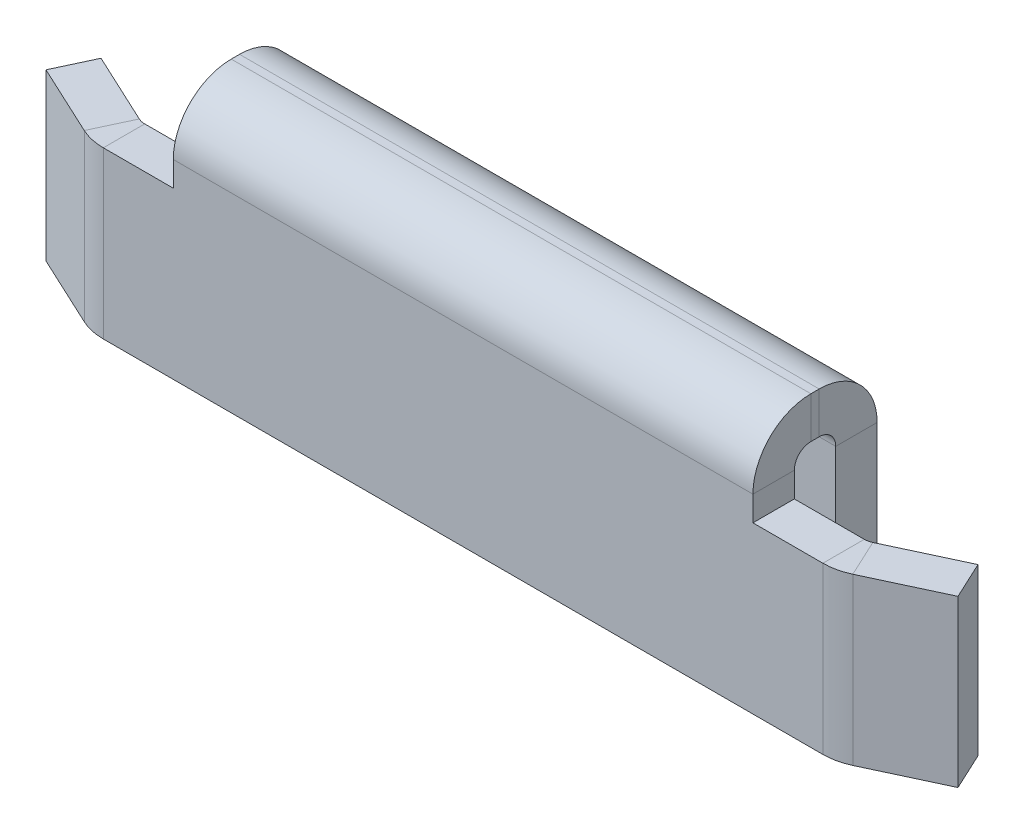
from build123d import *

# Parameters (mm, degrees)
BOSS_EXTRUDE1_DEPTH    = 25.4
SKETCH2_W              = 88.9
SKETCH2_H              = 6.35
BOSS_EXTRUDE2_DEPTH    = 12.7
SKETCH3_W              = 88.9
SKETCH3_H              = 6.35
BOSS_EXTRUDE3_DEPTH    = 12.7
SKETCH4_W              = 88.9
SKETCH4_H              = 6.35
BOSS_EXTRUDE5_DEPTH    = 25.4
FILLET4_R              = 2.54
CONVERT_SOLID1_START   = -1
CONVERT_SOLID1_DEPTH   = 32.8041528
CONVERT_SOLID1_START_2 = -44.45
CONVERT_SOLID1_2_DEPTH = 88.9
CUT_EXTRUDE1_REACH     = 83.887
SKETCH6_R              = 1.63195
UNFOLD1_START          = -12.7
UNFOLD1_OUTLINE_R      = 1.63195
UNFOLD1_DEPTH          = 12.7
UNFOLD1_2_OUTLINE_W    = 1.190330825
UNFOLD1_2_OUTLINE_H    = 25.4
UNFOLD1_2_DEPTH        = 1.940687
UNFOLD1_3_OUTLINE_W    = 88.9
UNFOLD1_3_OUTLINE_H    = 45.894202015
UNFOLD1_3_OUTLINE_R    = 1.63195
UNFOLD1_3_DEPTH        = 6.35
FOLD1_START            = 38.1
FOLD1_OUTLINE_W        = 88.9
FOLD1_OUTLINE_H        = 6.35
FOLD1_DEPTH            = 33.194202015
FOLD1_2_DEPTH          = 25.4
FOLD1_START_2          = 6.35
FOLD1_3_OUTLINE_W      = 88.9
FOLD1_3_OUTLINE_H      = 6.35
FOLD1_3_DEPTH          = 9.7980499
FOLD1_START_3          = 19.4119501
FOLD1_4_OUTLINE_W      = 88.9
FOLD1_4_OUTLINE_H      = 6.35
FOLD1_4_DEPTH          = 9.7980499
FOLD1_START_4          = 31.75
FOLD1_5_OUTLINE_W      = 88.9
FOLD1_5_OUTLINE_H      = 6.35
FOLD1_5_DEPTH          = 5.563988164
FOLD1_6_DEPTH          = 25.4
FOLD1_START_5          = -44.45
FOLD1_7_DEPTH          = 88.9
FOLD1_START_6          = -12.7
FOLD1_8_DEPTH          = 6.35
FOLD1_9_DEPTH          = 88.9


with BuildPart() as part:
    # Sketch1 → Boss-Extrude1 (new body)
    with BuildSketch(Plane(origin=(0, 0, 0), x_dir=(1, 0, 0), z_dir=(0, 1, 0))):
        Polygon((-57.15, -6.35), (57.15, -6.35), (69.93597375, -0.387802524), (67.252347788, 5.367251924), (55.742238892, 0), (-55.742238892, 0), (-67.252347788, 5.367251924), (-69.93597375, -0.387802524), align=None)
    extrude(amount=BOSS_EXTRUDE1_DEPTH)

    # Sketch2 → Boss-Extrude2 (add)
    with BuildSketch(Plane(origin=(0, 25.4, 0), x_dir=(1, 0, 0), z_dir=(0, 1, 0))):
        with Locations((0, -3.175)):
            Rectangle(SKETCH2_W, SKETCH2_H)
    extrude(amount=BOSS_EXTRUDE2_DEPTH)

    # Sketch3 → Boss-Extrude3 (add)
    with BuildSketch(Plane(origin=(0, 0, 0), x_dir=(-1, 0, 0), z_dir=(0, 0, -1))):
        with Locations((0, 34.925)):
            Rectangle(SKETCH3_W, SKETCH3_H)
    extrude(amount=BOSS_EXTRUDE3_DEPTH)

    # Sketch4 → Boss-Extrude5 (add)
    with BuildSketch(Plane.XZ.offset(-31.75)):
        with Locations((0, -9.525)):
            Rectangle(SKETCH4_W, SKETCH4_H)
    extrude(amount=BOSS_EXTRUDE5_DEPTH)

    # Fillet4
    fillet4_edges = [part.edges().sort_by_distance(p)[0] for p in [
        (57.15, 12.7, 6.35),
        (-57.15, 12.7, 6.35),
        (-55.742238892, 12.7, 0),
        (55.742238892, 12.7, 0),
        (0, 38.1, 6.35),
        (0, 31.75, -6.35),
        (0, 38.1, -12.7),
        (0, 31.75, 0),
    ]]
    fillet(fillet4_edges, radius=FILLET4_R)

    # Convert-Solid1: read off the stored shape, not the designer's step
    # Convert-Solid1 outline → Convert-Solid1 (cut)
    with BuildSketch(Plane(origin=(0, 0, 0), x_dir=(1, 0, 0), z_dir=(0, 1, 0)).offset(CONVERT_SOLID1_START)):
        with BuildLine():
            ThreePointArc((58.936210796, -5.517076227), (57.103282617, -6.139271503), (55.179134449, -6.35))
            Line((55.179134449, -6.35), (56.586895557, -6.35))
            ThreePointArc((56.586895557, -6.35), (57.136652176, -6.289791858), (57.660345942, -6.112021779))
            Line((57.660345942, -6.112021779), (58.936210796, -5.517076227))
        make_face()
        with BuildLine():
            Line((-56.586895557, -6.35), (-55.179134449, -6.35))
            ThreePointArc((-55.179134449, -6.35), (-57.103282617, -6.139271503), (-58.936210796, -5.517076227))
            Line((-58.936210796, -5.517076227), (-57.660345942, -6.112021779))
            ThreePointArc((-57.660345942, -6.112021779), (-57.136652176, -6.289791858), (-56.586895557, -6.35))
        make_face()
    extrude(amount=CONVERT_SOLID1_DEPTH, mode=Mode.SUBTRACT)

    # Convert-Solid1 2 outline → Convert-Solid1 2 (cut)
    with BuildSketch(Plane.YZ.offset(CONVERT_SOLID1_START_2)):
        with BuildLine():
            ThreePointArc((29.21, 6.35), (35.496179285, 3.746179285), (38.1, -2.54))
            Line((38.1, -2.54), (38.1, 3.81))
            ThreePointArc((38.1, 3.81), (37.356051224, 5.606051224), (35.56, 6.35))
            Line((35.56, 6.35), (29.21, 6.35))
        make_face()
        with BuildLine():
            ThreePointArc((38.1, -3.81), (35.496179285, -10.096179285), (29.21, -12.7))
            Line((29.21, -12.7), (35.56, -12.7))
            ThreePointArc((35.56, -12.7), (37.356051224, -11.956051224), (38.1, -10.16))
            Line((38.1, -10.16), (38.1, -3.81))
        make_face()
    extrude(amount=CONVERT_SOLID1_2_DEPTH, mode=Mode.SUBTRACT)

    # Sketch6 → Cut-Extrude1 (cut, up to next)
    with BuildSketch(Plane(origin=(0, 0, -12.7), x_dir=(-1, 0, 0), z_dir=(0, 0, -1)), mode=Mode.PRIVATE) as cut_extrude1_sk1:
        with Locations((-25.4, 17.78)):
            Circle(SKETCH6_R)
    cut_extrude1_tool1 = extrude(cut_extrude1_sk1.sketch, amount=-CUT_EXTRUDE1_REACH, mode=Mode.PRIVATE) & part.part
    # Sketch6 → Cut-Extrude1 (cut, up to next)
    with BuildSketch(Plane(origin=(0, 0, -12.7), x_dir=(-1, 0, 0), z_dir=(0, 0, -1)), mode=Mode.PRIVATE) as cut_extrude1_sk2:
        with Locations((25.4, 17.78)):
            Circle(SKETCH6_R)
    cut_extrude1_tool2 = extrude(cut_extrude1_sk2.sketch, amount=-CUT_EXTRUDE1_REACH, mode=Mode.PRIVATE) & part.part
    add(cut_extrude1_tool1.solids().sort_by_distance((25.4, 17.78, -12.7))[0], mode=Mode.SUBTRACT)
    add(cut_extrude1_tool2.solids().sort_by_distance((-25.4, 17.78, -12.7))[0], mode=Mode.SUBTRACT)

    # Unfold1: read off the stored shape, not the designer's step
    # Unfold1 outline → Unfold1 (cut)
    with BuildSketch(Plane.XY.offset(UNFOLD1_START)):
        Polygon((44.45, 38.1), (-44.45, 38.1), (-44.45, 25.4), (-69.809669175, 25.4), (-69.809669175, 0), (69.809669175, 0), (69.809669175, 25.4), (44.45, 25.4), align=None)
        with Locations((25.4, 17.78)):
            Circle(UNFOLD1_OUTLINE_R, mode=Mode.SUBTRACT)
        with Locations((-25.4, 17.78)):
            Circle(UNFOLD1_OUTLINE_R, mode=Mode.SUBTRACT)
    extrude(amount=UNFOLD1_DEPTH, mode=Mode.SUBTRACT)

    # Unfold1 2 outline → Unfold1 2 (cut)
    with BuildSketch(Plane.XY):
        with Locations((-70.404834588, 12.7)):
            Rectangle(UNFOLD1_2_OUTLINE_W, UNFOLD1_2_OUTLINE_H)
        with Locations((70.404834588, 12.7)):
            Rectangle(UNFOLD1_2_OUTLINE_W, UNFOLD1_2_OUTLINE_H)
    extrude(amount=UNFOLD1_2_DEPTH, mode=Mode.SUBTRACT)

    # Unfold1 3 outline → Unfold1 3 (add)
    # profile 1 of 2: a face of its own
    with BuildSketch(Plane.XY):
        with Locations((0, 48.347101008)):
            Rectangle(UNFOLD1_3_OUTLINE_W, UNFOLD1_3_OUTLINE_H)
        with Locations((-25.4, 59.864202015)):
            Circle(UNFOLD1_3_OUTLINE_R, mode=Mode.SUBTRACT)
        with Locations((25.4, 59.864202015)):
            Circle(UNFOLD1_3_OUTLINE_R, mode=Mode.SUBTRACT)
    # profile 2 of 2: a face of its own
    with BuildSketch(Plane.XY):
        Polygon((-44.45, 6.35), (-44.45, 25.4), (-69.809669175, 25.4), (-69.809669175, 0), (69.809669175, 0), (69.809669175, 25.4), (44.45, 25.4), (44.45, 6.35), align=None)
    extrude(amount=UNFOLD1_3_DEPTH)

    # Fold1: read off the stored shape, not the designer's step
    # Fold1 outline → Fold1 (cut)
    with BuildSketch(Plane(origin=(0, 0, 0), x_dir=(1, 0, 0), z_dir=(0, 1, 0)).offset(FOLD1_START)):
        with Locations((0, -3.175)):
            Rectangle(FOLD1_OUTLINE_W, FOLD1_OUTLINE_H)
    extrude(amount=FOLD1_DEPTH, mode=Mode.SUBTRACT)

    # Fold1 2 outline → Fold1 2 (cut)
    with BuildSketch(Plane(origin=(0, 0, 0), x_dir=(1, 0, 0), z_dir=(0, 1, 0))):
        with BuildLine():
            Line((-58.936210796, -5.517076227), (-69.809669175, -0.446699315))
            Line((-69.809669175, -0.446699315), (-69.809669175, -6.35))
            Line((-69.809669175, -6.35), (-55.179134449, -6.35))
            ThreePointArc((-55.179134449, -6.35), (-57.103282617, -6.139271503), (-58.936210796, -5.517076227))
        make_face()
        Polygon((-69.809669175, -0.116941489), (-69.755138463, 0), (-69.809669175, 0), align=None)
        with BuildLine():
            Line((69.809669175, -6.35), (69.809669175, -0.446699315))
            Line((69.809669175, -0.446699315), (58.936210796, -5.517076227))
            ThreePointArc((58.936210796, -5.517076227), (57.103282617, -6.139271503), (55.179134449, -6.35))
            Line((55.179134449, -6.35), (69.809669175, -6.35))
        make_face()
        Polygon((69.809669175, 0), (69.755138463, 0), (69.809669175, -0.116941489), align=None)
    extrude(amount=FOLD1_2_DEPTH, mode=Mode.SUBTRACT)

    # Fold1 3 outline → Fold1 3 (add)
    with BuildSketch(Plane(origin=(0, 0, 0), x_dir=(1, 0, 0), z_dir=(0, 1, 0)).offset(FOLD1_START_2)):
        with Locations((0, 9.525)):
            Rectangle(FOLD1_3_OUTLINE_W, FOLD1_3_OUTLINE_H)
        Polygon((-69.809669175, -0.446699315), (-69.809669175, -0.116941489), (-69.93597375, -0.387802524), align=None)
        with BuildLine():
            ThreePointArc((-55.179134449, 0), (-55.728891069, 0.060208142), (-56.252584834, 0.237978221))
            Line((-56.252584834, 0.237978221), (-67.252347788, 5.367251924))
            Line((-67.252347788, 5.367251924), (-69.755138463, 0))
            Line((-69.755138463, 0), (-55.179134449, 0))
        make_face()
        with BuildLine():
            Line((67.252347788, 5.367251924), (56.252584834, 0.237978221))
            ThreePointArc((56.252584834, 0.237978221), (55.728891069, 0.060208142), (55.179134449, 0))
            Line((55.179134449, 0), (69.755138463, 0))
            Line((69.755138463, 0), (67.252347788, 5.367251924))
        make_face()
        Polygon((69.93597375, -0.387802524), (69.809669175, -0.116941489), (69.809669175, -0.446699315), align=None)
    extrude(amount=FOLD1_3_DEPTH)

    # Fold1 5 outline → Fold1 5 (add)
    with BuildSketch(Plane(origin=(0, 0, 0), x_dir=(1, 0, 0), z_dir=(0, 1, 0)).offset(FOLD1_START_4)):
        with Locations((0, 3.175)):
            Rectangle(FOLD1_5_OUTLINE_W, FOLD1_5_OUTLINE_H)
    extrude(amount=FOLD1_5_DEPTH)

    # Fold1 6 outline → Fold1 6 (add)
    with BuildSketch(Plane(origin=(0, 0, 0), x_dir=(1, 0, 0), z_dir=(0, 1, 0))):
        Polygon((-69.809669175, -0.446699315), (-69.809669175, -0.116941489), (-69.93597375, -0.387802524), align=None)
        with BuildLine():
            ThreePointArc((-55.179134449, 0), (-55.728891069, 0.060208142), (-56.252584834, 0.237978221))
            Line((-56.252584834, 0.237978221), (-67.252347788, 5.367251924))
            Line((-67.252347788, 5.367251924), (-69.755138463, 0))
            Line((-69.755138463, 0), (-55.179134449, 0))
        make_face()
        with BuildLine():
            Line((67.252347788, 5.367251924), (56.252584834, 0.237978221))
            ThreePointArc((56.252584834, 0.237978221), (55.728891069, 0.060208142), (55.179134449, 0))
            Line((55.179134449, 0), (69.755138463, 0))
            Line((69.755138463, 0), (67.252347788, 5.367251924))
        make_face()
        Polygon((69.93597375, -0.387802524), (69.809669175, -0.116941489), (69.809669175, -0.446699315), align=None)
    extrude(amount=FOLD1_6_DEPTH)



with BuildPart() as body_2:
    # Fold1 4 outline → Fold1 4 (new body)
    with BuildSketch(Plane(origin=(0, 0, 0), x_dir=(1, 0, 0), z_dir=(0, 1, 0)).offset(FOLD1_START_3)):
        with Locations((0, 9.525)):
            Rectangle(FOLD1_4_OUTLINE_W, FOLD1_4_OUTLINE_H)
    extrude(amount=FOLD1_4_DEPTH)


with BuildPart() as part_1:
    add(part.part)

    add(body_2.part)  # Fold1 7 merges body 2
    # Fold1 7 outline → Fold1 7 (add)
    with BuildSketch(Plane.YZ.offset(FOLD1_START_5)):
        with BuildLine():
            ThreePointArc((29.21, -12.7), (35.496179285, -10.096179285), (38.1, -3.81))
            Line((38.1, -3.81), (38.1, -2.54))
            ThreePointArc((38.1, -2.54), (38.00686691, -1.256554415), (37.729418994, 0))
            Line((37.729418994, 0), (37.313988164, 0))
            Line((37.313988164, 0), (37.313988164, -6.35))
            Line((37.313988164, -6.35), (31.75, -6.35))
            Line((31.75, -6.35), (31.75, -3.81))
            ThreePointArc((31.75, -3.81), (31.006051224, -5.606051224), (29.21, -6.35))
            Line((29.21, -6.35), (29.21, -12.7))
        make_face()
        with BuildLine():
            ThreePointArc((29.21, 0), (31.006051224, -0.743948776), (31.75, -2.54))
            Line((31.75, -2.54), (31.75, 0))
            Line((31.75, 0), (29.21, 0))
        make_face()
    extrude(amount=FOLD1_7_DEPTH)

    # Fold1 8 outline → Fold1 8 (add)
    with BuildSketch(Plane.XY.offset(FOLD1_START_6)):
        with BuildLine():
            ThreePointArc((25.4, 19.41195), (27.03195, 17.78), (25.4, 16.14805))
            Line((25.4, 16.14805), (44.45, 16.1480499))
            Line((44.45, 16.1480499), (44.45, 19.4119501))
            Line((44.45, 19.4119501), (25.4, 19.41195))
        make_face()
        with BuildLine():
            ThreePointArc((25.4, 16.14805), (23.76805, 17.78), (25.4, 19.41195))
            Line((25.4, 19.41195), (-25.399999965, 19.41195))
            ThreePointArc((-25.399999965, 19.41195), (-23.76805, 17.779999965), (-25.400000035, 16.14805))
            Line((-25.400000035, 16.14805), (25.4, 16.14805))
        make_face()
        with BuildLine():
            ThreePointArc((-25.400000035, 16.14805), (-27.03195, 17.780000035), (-25.399999965, 19.41195))
            Line((-25.399999965, 19.41195), (-44.45, 19.4119501))
            Line((-44.45, 19.4119501), (-44.45, 16.1480499))
            Line((-44.45, 16.1480499), (-25.400000035, 16.14805))
        make_face()
    extrude(amount=FOLD1_8_DEPTH)

    # Fold1 9 outline → Fold1 9 (cut)
    with BuildSketch(Plane.YZ.offset(FOLD1_START_5)):
        with BuildLine():
            ThreePointArc((29.21, 6.35), (34.522791169, 4.587857322), (37.729418994, 0))
            Line((37.729418994, 0), (38.1, 0))
            Line((38.1, 0), (38.1, 6.35))
            Line((38.1, 6.35), (29.21, 6.35))
        make_face()
    extrude(amount=FOLD1_9_DEPTH, mode=Mode.SUBTRACT)


solid = part_1.part
